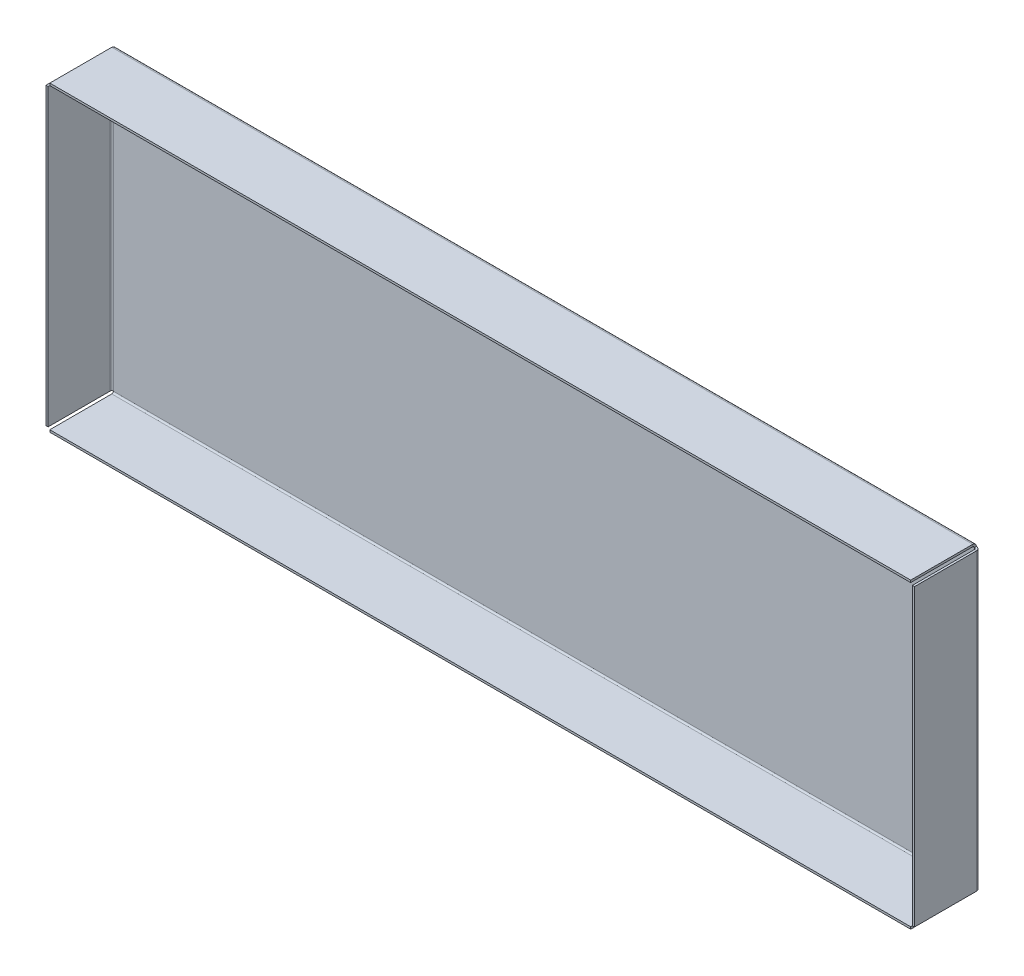
from build123d import *

# Parameters (mm, degrees)
BASE_FLANGE1_DEPTH         = 1
SKETCHED_START             = 31
SKETCHED_BEND1_DEPTH       = 138
SKETCHED_BEND1_2_DEPTH     = 403
SKETCHED_BEND1_3_OUTLINE_W = 403
SKETCHED_BEND1_3_OUTLINE_H = 1
SKETCHED_BEND1_3_DEPTH     = 29.234623369
SKETCHED_START_2           = 170.765376631
SKETCHED_BEND1_4_OUTLINE_W = 403
SKETCHED_BEND1_4_OUTLINE_H = 1
SKETCHED_BEND1_4_DEPTH     = 29.234623369
SKETCHED_BEND1_5_DEPTH     = 138
SKETCHED_BEND1_6_DEPTH     = 403
SKETCHED_BEND1_7_OUTLINE_W = 138
SKETCHED_BEND1_7_OUTLINE_H = 1
SKETCHED_BEND1_7_DEPTH     = 29.234623369
SKETCHED_START_3           = 435.765376631
SKETCHED_BEND1_8_OUTLINE_W = 138
SKETCHED_BEND1_8_OUTLINE_H = 1
SKETCHED_BEND1_8_DEPTH     = 29.234623369


# Read off the part's stored shape, not the designer's step: Sketched Bend1
# Sheet-metal steps are written as plain solids
with BuildPart() as part:
    # Sketch1 → Base-Flange1 (new body)
    with BuildSketch(Plane.XY):
        Polygon((0, 169), (31, 169), (31, 200), (434, 200), (434, 169), (465, 169), (465, 31), (434, 31), (434, 0), (31, 0), (31, 31), (0, 31), align=None)
    extrude(amount=-BASE_FLANGE1_DEPTH)

    # Sketched Bend1 outline → Sketched Bend1 (add)
    with BuildSketch(Plane(origin=(0, 0, 0), x_dir=(1, 0, 0), z_dir=(0, 1, 0)).offset(SKETCHED_START)):
        with BuildLine():
            Line((29.234623369, -0.7366), (29.234623369, -29.765376631))
            Line((29.234623369, -29.765376631), (30.234623369, -29.765376631))
            Line((30.234623369, -29.765376631), (30.234623369, -0.7366))
            ThreePointArc((30.234623369, -0.7366), (30.450368514, -0.215745145), (30.971223369, 0))
            Line((30.971223369, 0), (29.398582279, 0))
            ThreePointArc((29.398582279, 0), (29.276108612, -0.359286442), (29.234623369, -0.7366))
        make_face()
        with BuildLine():
            Line((435.601417721, 0), (434.028776631, 0))
            ThreePointArc((434.028776631, 0), (434.549631486, -0.215745145), (434.765376631, -0.7366))
            Line((434.765376631, -0.7366), (434.765376631, -29.765376631))
            Line((434.765376631, -29.765376631), (435.765376631, -29.765376631))
            Line((435.765376631, -29.765376631), (435.765376631, -0.7366))
            ThreePointArc((435.765376631, -0.7366), (435.723891388, -0.359286442), (435.601417721, 0))
        make_face()
    extrude(amount=SKETCHED_BEND1_DEPTH)

    # Sketched Bend1 2 outline → Sketched Bend1 2 (add)
    with BuildSketch(Plane.YZ.offset(SKETCHED_START)):
        with BuildLine():
            Line((169.028776631, 0), (170.601417721, 0))
            ThreePointArc((170.601417721, 0), (170.723891388, 0.359286442), (170.765376631, 0.7366))
            Line((170.765376631, 0.7366), (170.765376631, 29.765376631))
            Line((170.765376631, 29.765376631), (169.765376631, 29.765376631))
            Line((169.765376631, 29.765376631), (169.765376631, 0.7366))
            ThreePointArc((169.765376631, 0.7366), (169.549631486, 0.215745145), (169.028776631, 0))
        make_face()
        with BuildLine():
            ThreePointArc((29.234623369, 0.7366), (29.276108612, 0.359286442), (29.398582279, 0))
            Line((29.398582279, 0), (30.971223369, 0))
            ThreePointArc((30.971223369, 0), (30.450368514, 0.215745145), (30.234623369, 0.7366))
            Line((30.234623369, 0.7366), (30.234623369, 29.765376631))
            Line((30.234623369, 29.765376631), (29.234623369, 29.765376631))
            Line((29.234623369, 29.765376631), (29.234623369, 0.7366))
        make_face()
    extrude(amount=SKETCHED_BEND1_2_DEPTH)

    # Sketched Bend1 3 outline → Sketched Bend1 3 (cut)
    with BuildSketch(Plane(origin=(0, 0, 0), x_dir=(1, 0, 0), z_dir=(0, 1, 0))):
        with Locations((232.5, 0.5)):
            Rectangle(SKETCHED_BEND1_3_OUTLINE_W, SKETCHED_BEND1_3_OUTLINE_H)
    extrude(amount=SKETCHED_BEND1_3_DEPTH, mode=Mode.SUBTRACT)

    # Sketched Bend1 4 outline → Sketched Bend1 4 (cut)
    with BuildSketch(Plane(origin=(0, 0, 0), x_dir=(1, 0, 0), z_dir=(0, 1, 0)).offset(SKETCHED_START_2)):
        with Locations((232.5, 0.5)):
            Rectangle(SKETCHED_BEND1_4_OUTLINE_W, SKETCHED_BEND1_4_OUTLINE_H)
    extrude(amount=SKETCHED_BEND1_4_DEPTH, mode=Mode.SUBTRACT)

    # Sketched Bend1 5 outline → Sketched Bend1 5 (cut)
    with BuildSketch(Plane(origin=(0, 0, 0), x_dir=(1, 0, 0), z_dir=(0, 1, 0)).offset(SKETCHED_START)):
        with BuildLine():
            Line((0, 0), (29.398582279, 0))
            ThreePointArc((29.398582279, 0), (30.039397205, 0.728828115), (30.971223369, 1))
            Line((30.971223369, 1), (0, 1))
            Line((0, 1), (0, 0))
        make_face()
        with BuildLine():
            Line((465, 1), (434.028776631, 1))
            ThreePointArc((434.028776631, 1), (434.960602795, 0.728828115), (435.601417721, 0))
            Line((435.601417721, 0), (465, 0))
            Line((465, 0), (465, 1))
        make_face()
    extrude(amount=SKETCHED_BEND1_5_DEPTH, mode=Mode.SUBTRACT)

    # Sketched Bend1 6 outline → Sketched Bend1 6 (cut)
    with BuildSketch(Plane.YZ.offset(SKETCHED_START)):
        with BuildLine():
            ThreePointArc((170.601417721, 0), (169.960602795, -0.728828115), (169.028776631, -1))
            Line((169.028776631, -1), (200, -1))
            Line((200, -1), (200, 0))
            Line((200, 0), (170.601417721, 0))
        make_face()
        with BuildLine():
            Line((0, -1), (30.971223369, -1))
            ThreePointArc((30.971223369, -1), (30.039397205, -0.728828115), (29.398582279, 0))
            Line((29.398582279, 0), (0, 0))
            Line((0, 0), (0, -1))
        make_face()
    extrude(amount=SKETCHED_BEND1_6_DEPTH, mode=Mode.SUBTRACT)

    # Sketched Bend1 7 outline → Sketched Bend1 7 (cut)
    with BuildSketch(Plane.YZ):
        with Locations((100, -0.5)):
            Rectangle(SKETCHED_BEND1_7_OUTLINE_W, SKETCHED_BEND1_7_OUTLINE_H)
    extrude(amount=SKETCHED_BEND1_7_DEPTH, mode=Mode.SUBTRACT)

    # Sketched Bend1 8 outline → Sketched Bend1 8 (cut)
    with BuildSketch(Plane.YZ.offset(SKETCHED_START_3)):
        with Locations((100, -0.5)):
            Rectangle(SKETCHED_BEND1_8_OUTLINE_W, SKETCHED_BEND1_8_OUTLINE_H)
    extrude(amount=SKETCHED_BEND1_8_DEPTH, mode=Mode.SUBTRACT)


solid = part.part
